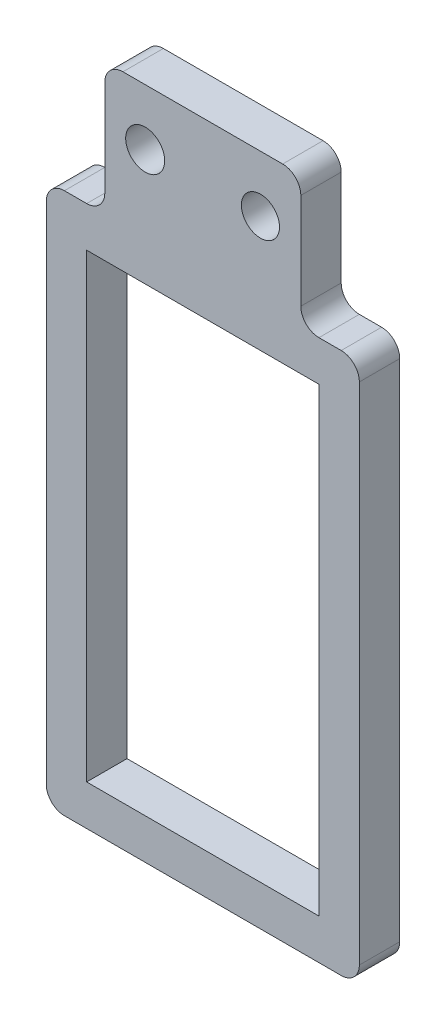
from build123d import *

# Parameters (mm, degrees)
SKETCH3_W           = 25.6
SKETCH3_H           = 50.75
SKETCH3_R           = 2.15
SKETCH3_R_2         = 2.1
BOSS_EXTRUDE1_DEPTH = 4.45
FILLET1_R           = 2


with BuildPart() as part:
    # Sketch3 → Boss-Extrude1 (new body)
    with BuildSketch(Plane.XY):
        Polygon((-4.45, -8.375), (-10.9, -8.375), (-10.9, -68.025), (23.6, -68.025), (23.6, -8.375), (17.15, -8.375), (17.15, 6.2), (-4.45, 6.2), align=None)
        with Locations((6.35, -38.2)):
            Rectangle(SKETCH3_W, SKETCH3_H, mode=Mode.SUBTRACT)
        Circle(SKETCH3_R, mode=Mode.SUBTRACT)
        with Locations((12.7, 0)):
            Circle(SKETCH3_R_2, mode=Mode.SUBTRACT)
    extrude(amount=BOSS_EXTRUDE1_DEPTH)

    # Fillet1
    fillet1_edges = [part.edges().sort_by_distance(p)[0] for p in [
        (-10.9, -68.025, 2.225),
        (23.6, -68.025, 2.225),
        (-10.9, -8.375, 2.225),
        (23.6, -8.375, 2.225),
        (17.15, -8.375, 2.225),
        (17.15, 6.2, 2.225),
        (-4.45, 6.2, 2.225),
        (-4.45, -8.375, 2.225),
    ]]
    fillet(fillet1_edges, radius=FILLET1_R)


solid = part.part
